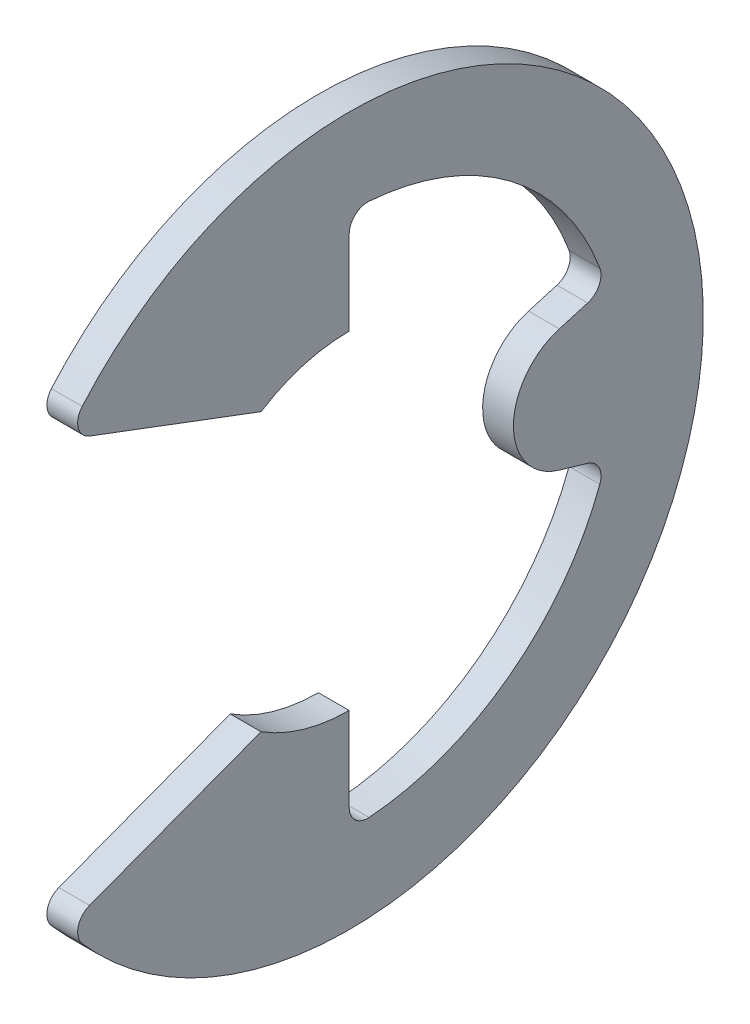
from build123d import *

# Parameters (mm, degrees)
EXTRUDE1_DEPTH = 0.15
FILLET1_R      = 0.18
FILLET2_START  = -1
FILLET2_DEPTH  = 2


with BuildPart() as part:
    # Sketch1 → Extrude1 (new, symmetric)
    with BuildSketch(Plane(origin=(0, 0, 0), x_dir=(0, 0, -1), z_dir=(1, 0, 0))):
        with BuildLine():
            Line((-2.761953542, -2.067392713), (-0.858778202, -1.35))
            ThreePointArc((-0.858778202, -1.35), (-0.447213595, -1.53622915), (0, -1.6))
            Line((0, -1.6), (0, -2.606451613))
            ThreePointArc((0, -2.606451613), (1.564404659, -2.084760915), (2.50256684, -0.728525373))
            Line((2.50256684, -0.728525373), (1.53622915, -0.447213595))
            ThreePointArc((1.53622915, -0.447213595), (1.6, 0), (1.53622915, 0.447213595))
            Line((1.53622915, 0.447213595), (2.50256684, 0.728525373))
            ThreePointArc((2.50256684, 0.728525373), (1.564404659, 2.084760915), (0, 2.606451613))
            Line((0, 2.606451613), (0, 1.6))
            ThreePointArc((0, 1.6), (-0.447213595, 1.53622915), (-0.858778202, 1.35))
            Line((-0.858778202, 1.35), (-2.761953542, 2.067392713))
            ThreePointArc((-2.761953542, 2.067392713), (3.45, 0), (-2.761953542, -2.067392713))
        make_face()
    extrude(amount=EXTRUDE1_DEPTH, both=True)

    # Fillet1
    fillet1_edges = [part.edges().sort_by_distance(p)[0] for p in [
        (0, -2.067392713, 2.761953542),
        (0, -2.606451613, 0),
        (0, -0.728525373, -2.50256684),
        (0, 0.728525373, -2.50256684),
        (0, 2.606451613, 0),
        (0, 2.067392713, 2.761953542),
    ]]
    fillet(fillet1_edges, radius=FILLET1_R)

    # Fillet2: read off the stored shape, not the designer's step
    # Fillet2 outline → Fillet2 (cut)
    with BuildSketch(Plane.YZ.offset(FILLET2_START)):
        with BuildLine():
            Line((-0.447213595, -1.53622915), (-0.595966919, -2.047213595))
            add(Edge.make_bspline(
                [(-0.595966919, -2.047213595), (-0.522890719, -1.796188606), (-0.310518672, -1.6), (0, -1.6)],
                knots=[0, 0, 0, 0, 0.5, 0.5, 0.5, 0.5], degree=3, weights=[1, 0.759836166, 0.639754249, 0.639754249]))
            ThreePointArc((0, -1.6), (-0.225868723, -1.583977058), (-0.447213595, -1.53622915))
        make_face()
        with BuildLine():
            ThreePointArc((0.447213595, -1.53622915), (0.225868723, -1.583977058), (0, -1.6))
            add(Edge.make_bspline(
                [(0, -1.6), (0.310518672, -1.6), (0.522890719, -1.796188606), (0.595966919, -2.047213595)],
                knots=[0.5, 0.5, 0.5, 0.5, 1, 1, 1, 1], degree=3, weights=[0.639754249, 0.639754249, 0.759836166, 1]))
            Line((0.595966919, -2.047213595), (0.447213595, -1.53622915))
        make_face()
    extrude(amount=FILLET2_DEPTH, mode=Mode.SUBTRACT)


solid = part.part
